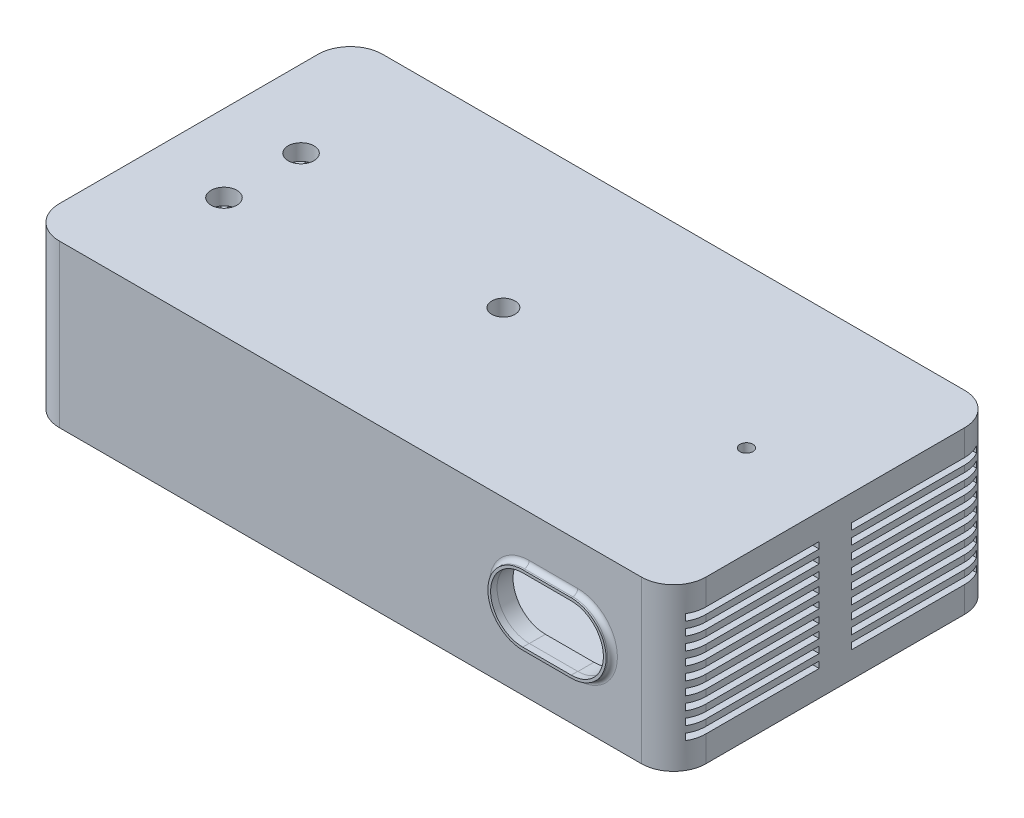
from build123d import *

# Parameters (mm, degrees)
SKETCH1_W           = 200
SKETCH1_H           = 100
BOSS_EXTRUDE1_DEPTH = 50
SKETCH2_W           = 190
SKETCH2_H           = 90
CUT_EXTRUDE1_DEPTH  = 45
CUT_EXTRUDE2_DEPTH  = 5
BOSS_EXTRUDE2_DEPTH = 2
CUT_EXTRUDE3_DEPTH  = 2
SKETCH18_R          = 6
BOSS_EXTRUDE3_DEPTH = 5
SKETCH19_R          = 6
BOSS_EXTRUDE4_DEPTH = 5
SKETCH27_W          = 40
SKETCH27_H          = 2
CUT_EXTRUDE18_DEPTH = 5
SKETCH28_W          = 40
SKETCH28_H          = 2
CUT_EXTRUDE19_DEPTH = 5
SKETCH30_W          = 40
SKETCH30_H          = 2
CUT_EXTRUDE20_DEPTH = 5
SKETCH31_W          = 40
SKETCH31_H          = 2
CUT_EXTRUDE21_DEPTH = 5
SKETCH32_W          = 40
SKETCH32_H          = 2
CUT_EXTRUDE22_DEPTH = 5
FILLET1_R           = 10
FILLET3_R           = 2
FILLET4_R           = 1.5
SKETCH33_R          = 3.2743396
BOSS_EXTRUDE5_DEPTH = 10
SKETCH34_R          = 2.138708563
CUT_EXTRUDE23_DEPTH = 8
SKETCH35_R          = 2.357784601
CUT_EXTRUDE24_DEPTH = 8
SKETCH36_R          = 2.299720376
SKETCH36_R_2        = 2.066956198
CUT_EXTRUDE25_DEPTH = 8
SKETCH37_W          = 190
SKETCH37_H          = 90
BOSS_EXTRUDE6_DEPTH = 5
SKETCH38_R          = 4
SKETCH38_R_2        = 2
SKETCH38_R_3        = 3.597061444
CUT_EXTRUDE26_DEPTH = 15


with BuildPart() as part:
    # Sketch1 → Boss-Extrude1 (new body)
    with BuildSketch(Plane(origin=(0, 0, 0), x_dir=(1, 0, 0), z_dir=(0, 1, 0))):
        with Locations((-1.350418812, -43.118740668)):
            Rectangle(SKETCH1_W, SKETCH1_H)
    extrude(amount=BOSS_EXTRUDE1_DEPTH)

    # Sketch2 → Cut-Extrude1 (cut)
    with BuildSketch(Plane(origin=(0, 50, 0), x_dir=(1, 0, 0), z_dir=(0, 1, 0))):
        with Locations((-1.350418812, -43.118740668)):
            Rectangle(SKETCH2_W, SKETCH2_H)
    extrude(amount=-CUT_EXTRUDE1_DEPTH, mode=Mode.SUBTRACT)

    # Sketch3 → Cut-Extrude2 (cut)
    with BuildSketch(Plane.XY.offset(93.118740668)):
        with BuildLine():
            Line((53.971496927, 34.832728999), (68.971496927, 34.832728999))
            ThreePointArc((68.971496927, 34.832728999), (78.971496927, 24.832728999), (68.971496927, 14.832728999))
            Line((68.971496927, 14.832728999), (53.971496927, 14.832728999))
            ThreePointArc((53.971496927, 14.832728999), (43.971496927, 24.832728999), (53.971496927, 34.832728999))
        make_face()
    extrude(amount=-CUT_EXTRUDE2_DEPTH, mode=Mode.SUBTRACT)

    # Sketch4 → Boss-Extrude2 (add)
    with BuildSketch(Plane.XY.offset(93.118740668)):
        with BuildLine():
            Line((53.971496927, 35.609411445), (68.971496927, 35.609411445))
            ThreePointArc((68.971496927, 35.609411445), (79.748179373, 24.832728999), (68.971496927, 14.056046554))
            Line((68.971496927, 14.056046554), (53.971496927, 14.056046554))
            ThreePointArc((53.971496927, 14.056046554), (43.194814481, 24.832728999), (53.971496927, 35.609411445))
        make_face()
    extrude(amount=BOSS_EXTRUDE2_DEPTH)

    # Sketch5 → Cut-Extrude3 (cut)
    with BuildSketch(Plane.XY.offset(95.118740668)):
        with BuildLine():
            Line((53.971496927, 34.777863765), (68.971496927, 34.777863765))
            ThreePointArc((68.971496927, 34.777863765), (78.916631693, 24.832728999), (68.971496927, 14.887594234))
            Line((68.971496927, 14.887594234), (53.971496927, 14.887594234))
            ThreePointArc((53.971496927, 14.887594234), (44.026362161, 24.832728999), (53.971496927, 34.777863765))
        make_face()
    extrude(amount=-CUT_EXTRUDE3_DEPTH, mode=Mode.SUBTRACT)

    # Sketch18 → Boss-Extrude3 (add)
    with BuildSketch(Plane.XZ):
        with Locations(Location((-86.350418812, 78.118740668, 0), (0, 0, 90))):
            Circle(SKETCH18_R)
    extrude(amount=BOSS_EXTRUDE3_DEPTH)

    # Sketch19 → Boss-Extrude4 (add)
    with BuildSketch(Plane.XZ):
        with Locations(Location((83.649581188, 78.118740668, 0), (0, 0, 90))):
            Circle(SKETCH19_R)
        with Locations(Location((83.649581188, 8.118740668, 0), (0, 0, 90))):
            Circle(SKETCH19_R)
        with Locations(Location((-86.350418812, 8.118740668, 0), (0, 0, 90))):
            Circle(SKETCH19_R)
    extrude(amount=BOSS_EXTRUDE4_DEPTH)

    # Sketch27 → Cut-Extrude18 (cut)
    with BuildSketch(Plane.ZY.offset(101.350418812)):
        with Locations((18.118740668, 21)):
            Rectangle(SKETCH27_W, SKETCH27_H)
        with Locations((18.118740668, 29)):
            Rectangle(SKETCH27_W, SKETCH27_H)
        with Locations((18.118740668, 33)):
            Rectangle(SKETCH27_W, SKETCH27_H)
        with Locations((18.118740668, 37)):
            Rectangle(SKETCH27_W, SKETCH27_H)
        with Locations((18.118740668, 17)):
            Rectangle(SKETCH27_W, SKETCH27_H)
        with Locations((18.118740668, 13)):
            Rectangle(SKETCH27_W, SKETCH27_H)
    extrude(amount=-CUT_EXTRUDE18_DEPTH, mode=Mode.SUBTRACT)

    # Sketch28 → Cut-Extrude19 (cut)
    with BuildSketch(Plane.ZY.offset(101.350418812)):
        with Locations((18.118740668, 25)):
            Rectangle(SKETCH28_W, SKETCH28_H)
    extrude(amount=-CUT_EXTRUDE19_DEPTH, mode=Mode.SUBTRACT)

    # Sketch30 → Cut-Extrude20 (cut)
    with BuildSketch(Plane.ZY.offset(101.350418812)):
        with Locations((68.118740668, 21)):
            Rectangle(SKETCH30_W, SKETCH30_H)
        with Locations((68.118740668, 17)):
            Rectangle(SKETCH30_W, SKETCH30_H)
        with Locations((68.118740668, 13)):
            Rectangle(SKETCH30_W, SKETCH30_H)
        with Locations((68.118740668, 33)):
            Rectangle(SKETCH30_W, SKETCH30_H)
        with Locations((68.118740668, 37)):
            Rectangle(SKETCH30_W, SKETCH30_H)
        with Locations((68.118740668, 29)):
            Rectangle(SKETCH30_W, SKETCH30_H)
        with Locations((68.118740668, 25)):
            Rectangle(SKETCH30_W, SKETCH30_H)
    extrude(amount=-CUT_EXTRUDE20_DEPTH, mode=Mode.SUBTRACT)

    # Sketch31 → Cut-Extrude21 (cut)
    with BuildSketch(Plane(origin=(98.649581188, 0, 0), x_dir=(0, 0, -1), z_dir=(1, 0, 0))):
        with Locations((-68.118740668, 25)):
            Rectangle(SKETCH31_W, SKETCH31_H)
        with Locations((-68.118740668, 29)):
            Rectangle(SKETCH31_W, SKETCH31_H)
        with Locations((-68.118740668, 33)):
            Rectangle(SKETCH31_W, SKETCH31_H)
        with Locations((-68.118740668, 37)):
            Rectangle(SKETCH31_W, SKETCH31_H)
        with Locations((-68.118740668, 41)):
            Rectangle(SKETCH31_W, SKETCH31_H)
        with Locations((-68.118740668, 21)):
            Rectangle(SKETCH31_W, SKETCH31_H)
        with Locations((-68.118740668, 17)):
            Rectangle(SKETCH31_W, SKETCH31_H)
        with Locations((-68.118740668, 13)):
            Rectangle(SKETCH31_W, SKETCH31_H)
        with Locations((-68.118740668, 9)):
            Rectangle(SKETCH31_W, SKETCH31_H)
    extrude(amount=-CUT_EXTRUDE21_DEPTH, mode=Mode.SUBTRACT)

    # Sketch32 → Cut-Extrude22 (cut)
    with BuildSketch(Plane(origin=(98.649581188, 0, 0), x_dir=(0, 0, -1), z_dir=(1, 0, 0))):
        with Locations((-18.118740668, 25)):
            Rectangle(SKETCH32_W, SKETCH32_H)
        with Locations((-18.118740668, 29)):
            Rectangle(SKETCH32_W, SKETCH32_H)
        with Locations((-18.118740668, 33)):
            Rectangle(SKETCH32_W, SKETCH32_H)
        with Locations((-18.118740668, 37)):
            Rectangle(SKETCH32_W, SKETCH32_H)
        with Locations((-18.118740668, 41)):
            Rectangle(SKETCH32_W, SKETCH32_H)
        with Locations((-18.118740668, 21)):
            Rectangle(SKETCH32_W, SKETCH32_H)
        with Locations((-18.118740668, 17)):
            Rectangle(SKETCH32_W, SKETCH32_H)
        with Locations((-18.118740668, 13)):
            Rectangle(SKETCH32_W, SKETCH32_H)
        with Locations((-18.118740668, 9)):
            Rectangle(SKETCH32_W, SKETCH32_H)
    extrude(amount=-CUT_EXTRUDE22_DEPTH, mode=Mode.SUBTRACT)

    # Fillet1
    # the kernel refuses this fillet: 10 mm, written as the material it takes off along each edge
    with BuildSketch(Plane(origin=(-101.350418812, -25, -6.881259332), x_dir=(1, 0, 0), z_dir=(0, 1, 0)), Plane(origin=(-101.350418812, -25, 93.118740668), x_dir=(0, 0, -1), z_dir=(0, 1, 0))) as fillet1_piece_1:
        with BuildLine():
            CenterArc((FILLET1_R, -FILLET1_R), FILLET1_R, 90, 90)
            Line((0, -FILLET1_R), (0, 0))
            Line((0, 0), (FILLET1_R, 0))
        make_face()
    extrude(amount=100, mode=Mode.SUBTRACT)
    with BuildSketch(Plane(origin=(98.649581188, -25, -6.881259332), x_dir=(-1, 0, 0), z_dir=(0, 1, 0)), Plane(origin=(98.649581188, -25, 93.118740668), x_dir=(0, 0, -1), z_dir=(0, 1, 0))) as fillet1_piece_2:
        with BuildLine():
            CenterArc((FILLET1_R, FILLET1_R), FILLET1_R, 180, 90)
            Line((0, FILLET1_R), (0, 0))
            Line((0, 0), (FILLET1_R, 0))
        make_face()
    extrude(amount=100, mode=Mode.SUBTRACT)

    # Fillet3
    fillet3_edges = [part.edges().sort_by_distance(p)[0] for p in [
        (-86.350418812, 0, 72.118740668),
        (-86.350418812, -5, 72.118740668),
        (83.649581188, 0, 72.118740668),
        (83.649581188, -5, 72.118740668),
        (83.649581188, 0, 2.118740668),
        (83.649581188, -5, 2.118740668),
        (-86.350418812, 0, 2.118740668),
        (-86.350418812, -5, 2.118740668),
    ]]
    fillet(fillet3_edges, radius=FILLET3_R)

    # Fillet4
    fillet4_edges = [part.edges().sort_by_distance(p)[0] for p in [
        (43.194814481, 24.832728999, 93.118740668),
        (61.471496927, 14.056046554, 93.118740668),
        (79.748179373, 24.832728999, 93.118740668),
        (61.471496927, 35.609411445, 93.118740668),
    ]]
    fillet(fillet4_edges, radius=FILLET4_R)

    # Sketch33 → Boss-Extrude5 (add)
    with BuildSketch(Plane(origin=(0, 5, 0), x_dir=(1, 0, 0), z_dir=(0, 1, 0))):
        with Locations(Location((-72.600418812, -20.618740668, 0), (0, 0, 270))):
            Circle(SKETCH33_R)
        with Locations(Location((69.899581188, -20.618740668, 0), (0, 0, 90))):
            Circle(SKETCH33_R)
        with Locations(Location((69.899581188, -65.618740668, 0), (0, 0, 270))):
            Circle(SKETCH33_R)
        with Locations(Location((-72.600418812, -65.618740668, 0), (0, 0, 90))):
            Circle(SKETCH33_R)
    extrude(amount=BOSS_EXTRUDE5_DEPTH)

    # Sketch34 → Cut-Extrude23 (cut)
    with BuildSketch(Plane(origin=(0, 15, 0), x_dir=(1, 0, 0), z_dir=(0, 1, 0))):
        with Locations(Location((-72.600418812, -20.618740668, 0), (0, 0, 270))):
            Circle(SKETCH34_R)
    extrude(amount=-CUT_EXTRUDE23_DEPTH, mode=Mode.SUBTRACT)

    # Sketch35 → Cut-Extrude24 (cut)
    with BuildSketch(Plane(origin=(0, 15, 0), x_dir=(1, 0, 0), z_dir=(0, 1, 0))):
        with Locations(Location((69.899581188, -20.618740668, 0), (0, 0, 270))):
            Circle(SKETCH35_R)
    extrude(amount=-CUT_EXTRUDE24_DEPTH, mode=Mode.SUBTRACT)

    # Sketch36 → Cut-Extrude25 (cut)
    with BuildSketch(Plane(origin=(0, 15, 0), x_dir=(1, 0, 0), z_dir=(0, 1, 0))):
        with Locations(Location((69.983893873, -65.694558952, 0), (0, 0, 270))):
            Circle(SKETCH36_R)
        with Locations(Location((-72.600418812, -65.618740668, 0), (0, 0, 270))):
            Circle(SKETCH36_R_2)
    extrude(amount=-CUT_EXTRUDE25_DEPTH, mode=Mode.SUBTRACT)

    # Sketch37 → Boss-Extrude6 (add)
    with BuildSketch(Plane(origin=(0, 50, 0), x_dir=(1, 0, 0), z_dir=(0, 1, 0))):
        with Locations((-1.350418812, -43.118740668)):
            Rectangle(SKETCH37_W, SKETCH37_H)
    extrude(amount=-BOSS_EXTRUDE6_DEPTH)

    # Sketch38 → Cut-Extrude26 (cut)
    with BuildSketch(Plane(origin=(0, 50, 0), x_dir=(1, 0, 0), z_dir=(0, 1, 0))):
        with Locations(Location((-77.46986656, -32.248277545, 0), (0, 0, 270))):
            Circle(SKETCH38_R)
        with Locations(Location((-77.46986656, -56.068250923, 0), (0, 0, 270))):
            Circle(SKETCH38_R)
        with Locations(Location((70.33493242, -42.297682662, 0), (0, 0, 270))):
            Circle(SKETCH38_R_2)
        with Locations(Location((-4.828475747, -42.297682662, 0), (0, 0, 270))):
            Circle(SKETCH38_R_3)
    extrude(amount=-CUT_EXTRUDE26_DEPTH, mode=Mode.SUBTRACT)


solid = part.part
